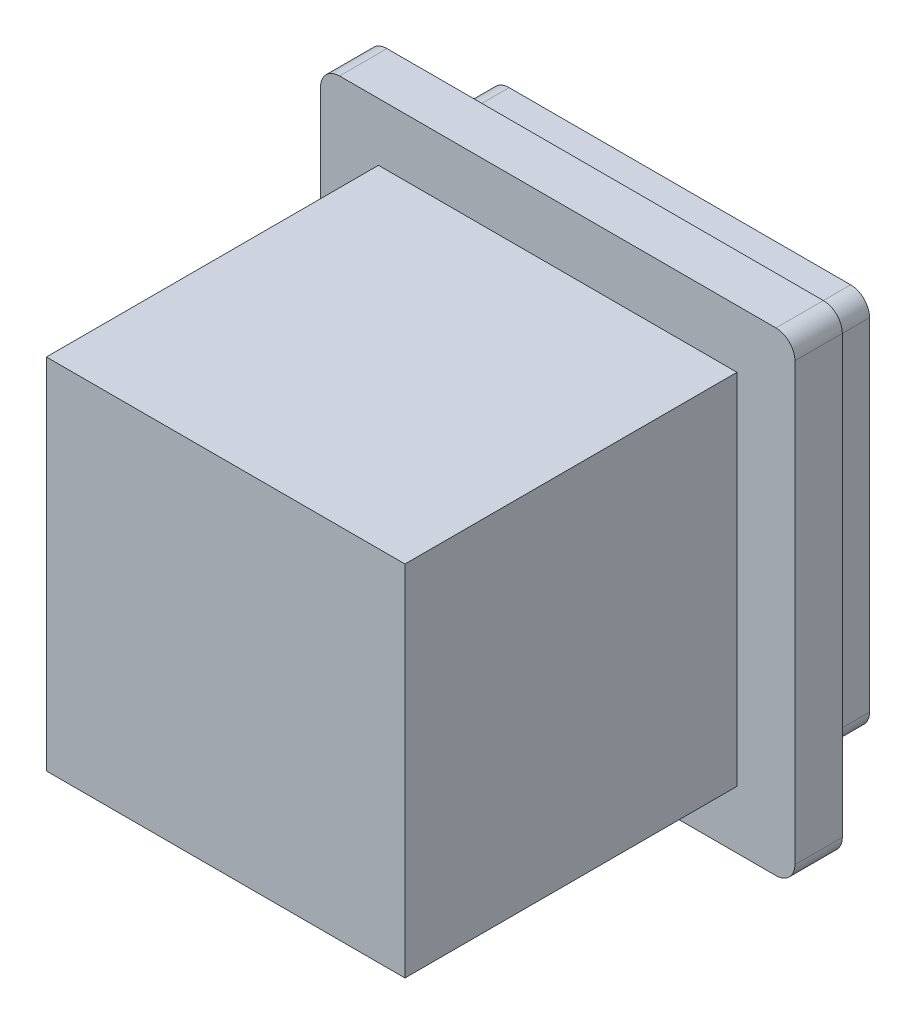
from build123d import *

# Parameters (mm, degrees)
SKETCH1_W           = 25.4
SKETCH1_H           = 25.4
BOSS_EXTRUDE1_DEPTH = 5
FILLET1_R           = 1.27
SKETCH3_W           = 2.54
SKETCH3_H           = 7.62
CUT_EXTRUDE1_DEPTH  = 2.54
SKETCH4_W           = 31.75
SKETCH4_H           = 31.75
BOSS_EXTRUDE2_DEPTH = 3.175
SKETCH2_W           = 24
SKETCH2_H           = 24
BOSS_EXTRUDE3_DEPTH = 25.4
FILLET2_R           = 1.27


with BuildPart() as part:
    # Sketch1 → Boss-Extrude1 (new body)
    with BuildSketch(Plane.XY):
        with Locations((12.7, 12.7)):
            Rectangle(SKETCH1_W, SKETCH1_H)
    extrude(amount=BOSS_EXTRUDE1_DEPTH)

    # Fillet1
    fillet1_edges = [part.edges().sort_by_distance(p)[0] for p in [
        (0, 0, 2.5),
        (25.4, 0, 2.5),
        (0, 25.4, 2.5),
        (25.4, 25.4, 2.5),
    ]]
    fillet(fillet1_edges, radius=FILLET1_R)

    # Sketch3 → Cut-Extrude1 (cut)
    with BuildSketch(Plane(origin=(0, 0, 0), x_dir=(-1, 0, 0), z_dir=(0, 0, -1))):
        with Locations((-17.78, 17.78)):
            Rectangle(SKETCH3_W, SKETCH3_H)
        with Locations((-7.62, 17.78)):
            Rectangle(SKETCH3_W, SKETCH3_H)
        with BuildLine():
            Line((-16.164953657, 5.08), (-16.164953657, 8.636))
            ThreePointArc((-16.164953657, 8.636), (-13.624953657, 10.494493494), (-11.084953657, 8.636))
            Line((-11.084953657, 8.636), (-11.084953657, 5.08))
            Line((-11.084953657, 5.08), (-16.164953657, 5.08))
        make_face()
    extrude(amount=-CUT_EXTRUDE1_DEPTH, mode=Mode.SUBTRACT)

    # Sketch4 → Boss-Extrude2 (add)
    with BuildSketch(Plane.XY.offset(5)):
        with Locations((12.7, 12.7)):
            Rectangle(SKETCH4_W, SKETCH4_H)
    extrude(amount=BOSS_EXTRUDE2_DEPTH)

    # Sketch2 → Boss-Extrude3 (add)
    with BuildSketch(Plane.XY.offset(5)):
        with Locations((12.7, 12.7)):
            Rectangle(SKETCH2_W, SKETCH2_H)
    extrude(amount=BOSS_EXTRUDE3_DEPTH)

    # Fillet2
    fillet2_edges = [part.edges().sort_by_distance(p)[0] for p in [
        (28.575, -3.175, 6.5875),
        (-3.175, -3.175, 6.5875),
        (-3.175, 28.575, 6.5875),
        (28.575, 28.575, 6.5875),
    ]]
    fillet(fillet2_edges, radius=FILLET2_R)


solid = part.part
